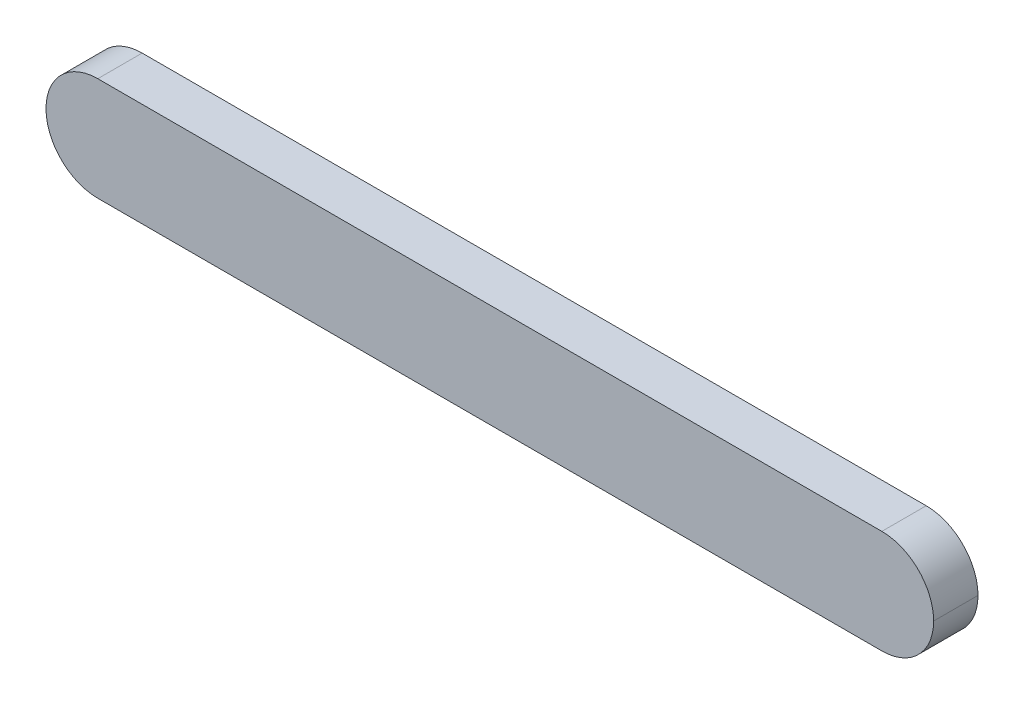
from build123d import *

# Parameters (mm, degrees)
SKETCH1_W           = 60
SKETCH1_H           = 7
BOSS_EXTRUDE1_DEPTH = 3
FILLET1_R           = 3.5


with BuildPart() as part:
    # Sketch1 → Boss-Extrude1 (new body)
    with BuildSketch(Plane.XY):
        Rectangle(SKETCH1_W, SKETCH1_H)
    extrude(amount=BOSS_EXTRUDE1_DEPTH)

    # Fillet1
    fillet1_edges = [part.edges().sort_by_distance(p)[0] for p in [
        (-30, -3.5, 1.5),
        (-30, 3.5, 1.5),
        (30, -3.5, 1.5),
        (30, 3.5, 1.5),
    ]]
    fillet(fillet1_edges, radius=FILLET1_R - 0.0001)  # a hair under: the kernel refuses the full size


solid = part.part
